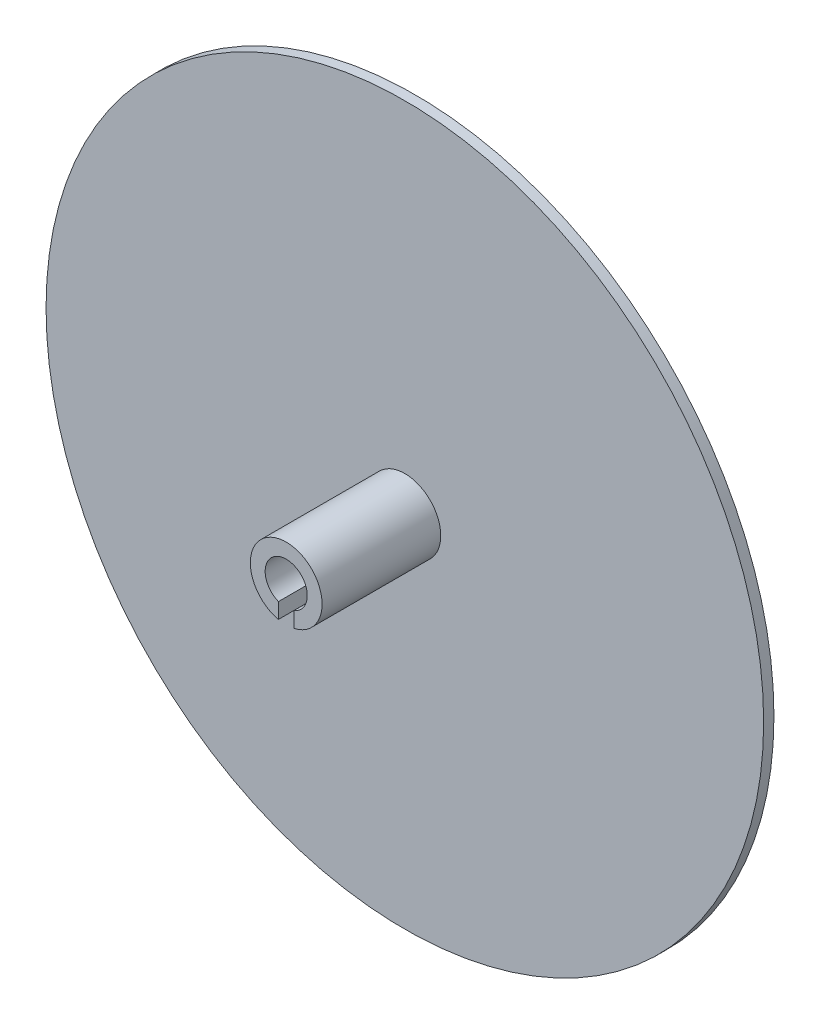
from build123d import *

# Parameters (mm, degrees)
SCHIZZO1_R                   = 150
ESTRUSIONE_ESTRUSIONE1_DEPTH = 4.3
SCHIZZO2_R                   = 15
SCHIZZO2_R_2                 = 8.8
ESTRUSIONE_ESTRUSIONE2_DEPTH = 49.6
TAGLIO_ESTRUSIONE1_START     = -17.25
TAGLIO_ESTRUSIONE1_DEPTH     = 17.25


with BuildPart() as part:
    # Schizzo1 → Estrusione-Estrusione1 (new body)
    with BuildSketch(Plane.XY):
        Circle(SCHIZZO1_R)
    extrude(amount=ESTRUSIONE_ESTRUSIONE1_DEPTH)

    # Schizzo2 → Estrusione-Estrusione2 (add)
    with BuildSketch(Plane.XY.offset(4.3)):
        Circle(SCHIZZO2_R)
        Circle(SCHIZZO2_R_2, mode=Mode.SUBTRACT)
    extrude(amount=ESTRUSIONE_ESTRUSIONE2_DEPTH)

    # Schizzo3 → Taglio-Estrusione1 (cut)
    with BuildSketch(Plane.XY.offset(53.9).offset(TAGLIO_ESTRUSIONE1_START)):
        with BuildLine():
            ThreePointArc((3.25, -8.17786647), (0, -8.8), (-3.25, -8.17786647))
            Line((-3.25, -8.17786647), (-3.25, -14.643684646))
            ThreePointArc((-3.25, -14.643684646), (0, -15), (3.25, -14.643684646))
            Line((3.25, -14.643684646), (3.25, -8.17786647))
        make_face()
    extrude(amount=TAGLIO_ESTRUSIONE1_DEPTH, mode=Mode.SUBTRACT)


solid = part.part
